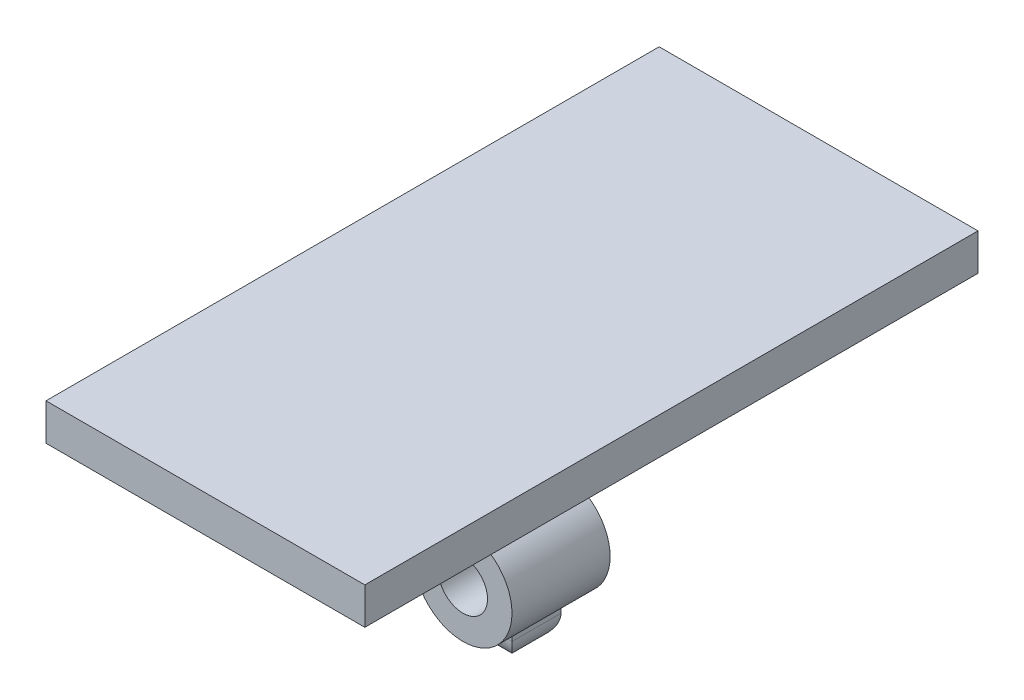
from build123d import *

# Parameters (mm, degrees)
SKETCH1_W                = 130
SKETCH1_H                = 15
BOSS_EXTRUDE1_DEPTH      = 250
SKETCH2_W                = 20
SKETCH2_H                = 20
BOSS_EXTRUDE3_DEPTH      = 100
BOSS_EXTRUDE4_DEPTH      = 10
BOSS_EXTRUDE4_DEPTH_BACK = 30
SKETCH3_R                = 20
SKETCH3_R_2              = 10
SKETCH4_R                = 10
CUT_EXTRUDE1_DEPTH       = 185.407836059
FILLET1_R                = 10


with BuildPart() as part:
    # Sketch1 → Boss-Extrude1 (new body)
    with BuildSketch(Plane.XY):
        Rectangle(SKETCH1_W, SKETCH1_H)
    extrude(amount=BOSS_EXTRUDE1_DEPTH)

    # Sketch2 → Boss-Extrude3 (add)
    with BuildSketch(Plane.XZ.offset(7.5)):
        with Locations((0, 125)):
            Rectangle(SKETCH2_W, SKETCH2_H)
    extrude(amount=BOSS_EXTRUDE3_DEPTH)

    # Sketch3 → Boss-Extrude4 (add, two sides: drawn at the far end of the back side and taken through both)
    with BuildSketch(Plane.XY.offset(135).offset(-BOSS_EXTRUDE4_DEPTH_BACK)):
        with Locations((0, -77.5)):
            Circle(SKETCH3_R)
        with Locations((0, -77.5)):
            Circle(SKETCH3_R_2, mode=Mode.SUBTRACT)
    extrude(amount=BOSS_EXTRUDE4_DEPTH + BOSS_EXTRUDE4_DEPTH_BACK)

    # Sketch4 → Cut-Extrude1 (cut, through all)
    with BuildSketch(Plane.XY.offset(135)):
        with Locations((0, -77.5)):
            Circle(SKETCH4_R)
    extrude(amount=-CUT_EXTRUDE1_DEPTH, mode=Mode.SUBTRACT)

    # Fillet1
    fillet1_edges = [part.edges().sort_by_distance(p)[0] for p in [
        (10, -107.5, 125),
        (0, -107.5, 135),
        (-10, -107.5, 125),
        (0, -107.5, 115),
    ]]
    fillet(fillet1_edges, radius=FILLET1_R - 0.0001)  # a hair under: the kernel refuses the full size


solid = part.part
